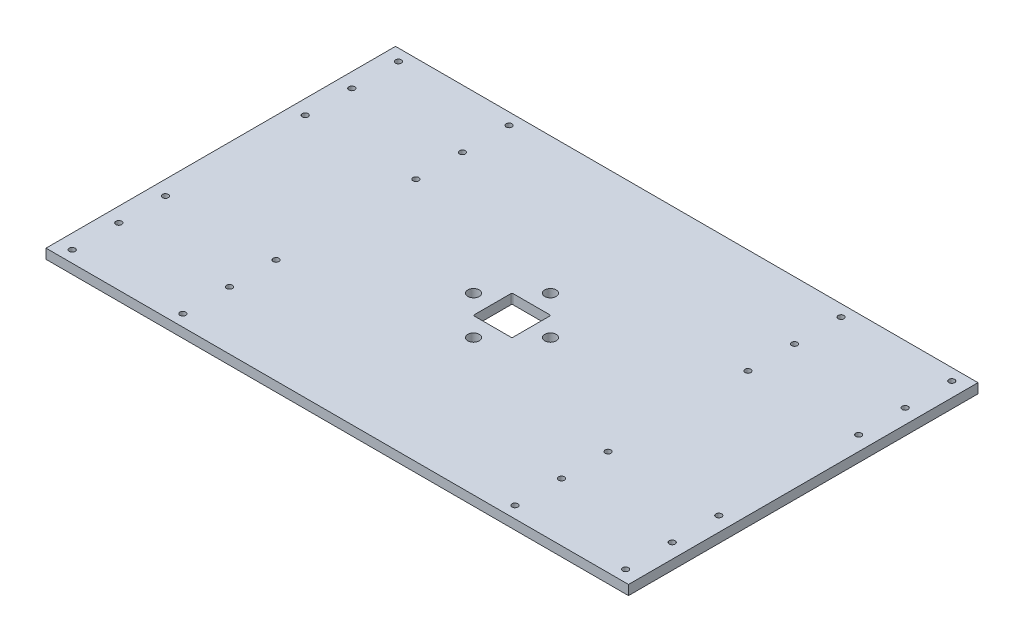
from build123d import *

# Parameters (mm, degrees)
SKETCH1_W           = 300
SKETCH1_H           = 180
SKETCH1_R           = 1.5
SKETCH1_R_2         = 2.95
BOSS_EXTRUDE1_DEPTH = 5


with BuildPart() as part:
    # Sketch1 → Boss-Extrude1 (new body)
    with BuildSketch(Plane(origin=(0, 0, 0), x_dir=(1, 0, 0), z_dir=(0, 1, 0))):
        Rectangle(SKETCH1_W, SKETCH1_H)
        with Locations((-142.5, 84)):
            Circle(SKETCH1_R, mode=Mode.SUBTRACT)
        with Locations((-142.5, 60)):
            Circle(SKETCH1_R, mode=Mode.SUBTRACT)
        with Locations((-142.5, 36)):
            Circle(SKETCH1_R, mode=Mode.SUBTRACT)
        with Locations((-85.5, 84)):
            Circle(SKETCH1_R, mode=Mode.SUBTRACT)
        with Locations((-85.5, 60)):
            Circle(SKETCH1_R, mode=Mode.SUBTRACT)
        with Locations((-85.5, 36)):
            Circle(SKETCH1_R, mode=Mode.SUBTRACT)
        with Locations((85.5, 36)):
            Circle(SKETCH1_R, mode=Mode.SUBTRACT)
        with Locations((85.5, 60)):
            Circle(SKETCH1_R, mode=Mode.SUBTRACT)
        with Locations((85.5, 84)):
            Circle(SKETCH1_R, mode=Mode.SUBTRACT)
        with Locations((142.5, 36)):
            Circle(SKETCH1_R, mode=Mode.SUBTRACT)
        with Locations((142.5, 60)):
            Circle(SKETCH1_R, mode=Mode.SUBTRACT)
        with Locations((142.5, 84)):
            Circle(SKETCH1_R, mode=Mode.SUBTRACT)
        with Locations((142.5, -84)):
            Circle(SKETCH1_R, mode=Mode.SUBTRACT)
        with Locations((142.5, -60)):
            Circle(SKETCH1_R, mode=Mode.SUBTRACT)
        with Locations((142.5, -36)):
            Circle(SKETCH1_R, mode=Mode.SUBTRACT)
        with Locations((85.5, -84)):
            Circle(SKETCH1_R, mode=Mode.SUBTRACT)
        with Locations((85.5, -60)):
            Circle(SKETCH1_R, mode=Mode.SUBTRACT)
        with Locations((85.5, -36)):
            Circle(SKETCH1_R, mode=Mode.SUBTRACT)
        with Locations((-85.5, -36)):
            Circle(SKETCH1_R, mode=Mode.SUBTRACT)
        with Locations((-85.5, -60)):
            Circle(SKETCH1_R, mode=Mode.SUBTRACT)
        with Locations((-85.5, -84)):
            Circle(SKETCH1_R, mode=Mode.SUBTRACT)
        with Locations((-142.5, -36)):
            Circle(SKETCH1_R, mode=Mode.SUBTRACT)
        with Locations((-142.5, -60)):
            Circle(SKETCH1_R, mode=Mode.SUBTRACT)
        with Locations((-142.5, -84)):
            Circle(SKETCH1_R, mode=Mode.SUBTRACT)
        with Locations((0, 19.8)):
            Circle(SKETCH1_R_2, mode=Mode.SUBTRACT)
        with Locations((19.8, 0)):
            Circle(SKETCH1_R_2, mode=Mode.SUBTRACT)
        with Locations((0, -19.8)):
            Circle(SKETCH1_R_2, mode=Mode.SUBTRACT)
        with Locations((-19.8, 0)):
            Circle(SKETCH1_R_2, mode=Mode.SUBTRACT)
        with BuildLine():
            Line((-9.5, -10), (9.5, -10))
            ThreePointArc((9.5, -10), (9.853553391, -9.853553391), (10, -9.5))
            Line((10, -9.5), (10, 9.5))
            ThreePointArc((10, 9.5), (9.853553391, 9.853553391), (9.5, 10))
            Line((9.5, 10), (-9.5, 10))
            ThreePointArc((-9.5, 10), (-9.853553391, 9.853553391), (-10, 9.5))
            Line((-10, 9.5), (-10, -9.5))
            ThreePointArc((-10, -9.5), (-9.853553391, -9.853553391), (-9.5, -10))
        make_face(mode=Mode.SUBTRACT)
    extrude(amount=BOSS_EXTRUDE1_DEPTH)


solid = part.part
